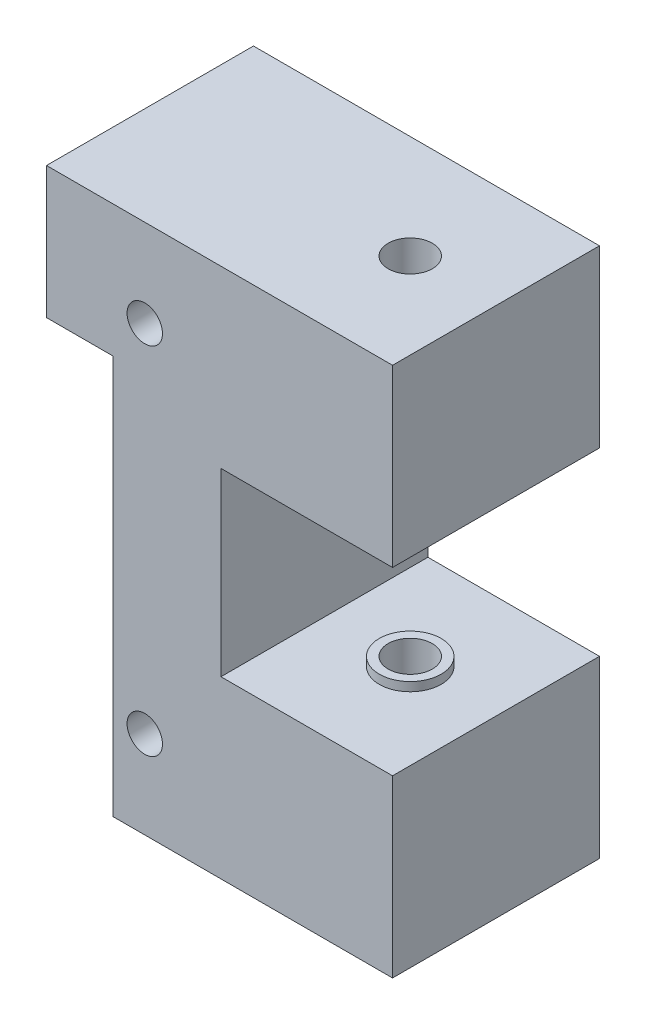
from build123d import *

# Parameters (mm, degrees)
MAINBLOCK_R                     = 2
MAINBLOCKBOSS_EXTRUDE1_DEPTH    = 23.4
TOPHOLECUT_SKETCH2_R            = 2.5
TOPHOLECUT_EXTRUDE1_DEPTH       = 45
TOPSPACERSKETCH4_R              = 3.5
TOPSPACERSKETCH4_R_2            = 2.5
TOPSPACERBOSS_EXTRUDE2_DEPTH    = 1
LOWERSPACERBOSS_EXTRUDE3_START  = 1
LOWERSPACERSKETCH5_R            = 3.5
LOWERSPACERSKETCH5_R_2          = 2.5
LOWERSPACERBOSS_EXTRUDE3_DEPTH  = 1
MOUNTHOLEBORECUT_EXTRUDE1_DEPTH = 2
PUSHPINHOLESKETCH1_R            = 1
PUSHPINHOLECUT_EXTRUDE1_DEPTH   = 76.354665582
MIDRAILINSETSKETCH1_W           = 7.5
MIDRAILINSETSKETCH1_H           = 45.1
MIDRAILINSETCUT_EXTRUDE2_DEPTH  = 76.354665582


with BuildPart() as part:
    # MainBlock → MainBlockBoss-Extrude1 (new body)
    with BuildSketch(Plane.XY):
        Polygon((0, 0), (39.125, 0), (39.125, 19.8), (19.725, 19.8), (19.725, 40.2), (39.125, 40.2), (39.125, 60), (0, 60), align=None)
        with Locations((11.1125, 50.1)):
            Circle(MAINBLOCK_R, mode=Mode.SUBTRACT)
        with Locations((11.1125, 9.9)):
            Circle(MAINBLOCK_R, mode=Mode.SUBTRACT)
    extrude(amount=MAINBLOCKBOSS_EXTRUDE1_DEPTH)

    # TopHoleCut-Sketch2 → TopHoleCut-Extrude1 (cut)
    with BuildSketch(Plane(origin=(0, 60, 0), x_dir=(1, 0, 0), z_dir=(0, 1, 0))):
        with Locations((29.425, -11.7)):
            Circle(TOPHOLECUT_SKETCH2_R)
    extrude(amount=-TOPHOLECUT_EXTRUDE1_DEPTH, mode=Mode.SUBTRACT)

    # TopSpacerSketch4 → TopSpacerBoss-Extrude2 (add)
    with BuildSketch(Plane.XZ.offset(-40.2)):
        with Locations((29.425, 11.7)):
            Circle(TOPSPACERSKETCH4_R)
        with Locations((29.425, 11.7)):
            Circle(TOPSPACERSKETCH4_R_2, mode=Mode.SUBTRACT)
    extrude(amount=TOPSPACERBOSS_EXTRUDE2_DEPTH)

    # LowerSpacerSketch5 → LowerSpacerBoss-Extrude3 (add)
    with BuildSketch(Plane(origin=(0, 19.8, 0), x_dir=(1, 0, 0), z_dir=(0, 1, 0)).offset(LOWERSPACERBOSS_EXTRUDE3_START)):
        with Locations((29.425, -11.7)):
            Circle(LOWERSPACERSKETCH5_R)
        with Locations((29.425, -11.7)):
            Circle(LOWERSPACERSKETCH5_R_2, mode=Mode.SUBTRACT)
    extrude(amount=-LOWERSPACERBOSS_EXTRUDE3_DEPTH)

    # MountHoleBoreSketch1 → MountHoleBoreCut-Extrude1 (cut)
    with BuildSketch(Plane(origin=(0, 0, 0), x_dir=(-1, 0, 0), z_dir=(0, 0, -1))):
        Polygon((-7.2375, 50.1), (-9.175, 53.45584844), (-13.05, 53.45584844), (-14.9875, 50.1), (-13.05, 46.74415156), (-9.175, 46.74415156), align=None)
        Polygon((-7.2375, 9.9), (-9.175, 13.25584844), (-13.05, 13.25584844), (-14.9875, 9.9), (-13.05, 6.54415156), (-9.175, 6.54415156), align=None)
    extrude(amount=-MOUNTHOLEBORECUT_EXTRUDE1_DEPTH, mode=Mode.SUBTRACT)

    # PushPinHoleSketch1 → PushPinHoleCut-Extrude1 (cut, through all)
    with BuildSketch(Plane.XZ):
        with Locations((29.425, 11.7)):
            Circle(PUSHPINHOLESKETCH1_R)
    extrude(amount=-PUSHPINHOLECUT_EXTRUDE1_DEPTH, mode=Mode.SUBTRACT)

    # MidRailInsetSketch1 → MidRailInsetCut-Extrude2 (cut, through all)
    with BuildSketch(Plane(origin=(0, 0, 0), x_dir=(-1, 0, 0), z_dir=(0, 0, -1))):
        with Locations((-3.75, 22.55)):
            Rectangle(MIDRAILINSETSKETCH1_W, MIDRAILINSETSKETCH1_H)
    extrude(amount=-MIDRAILINSETCUT_EXTRUDE2_DEPTH, mode=Mode.SUBTRACT)


solid = part.part
